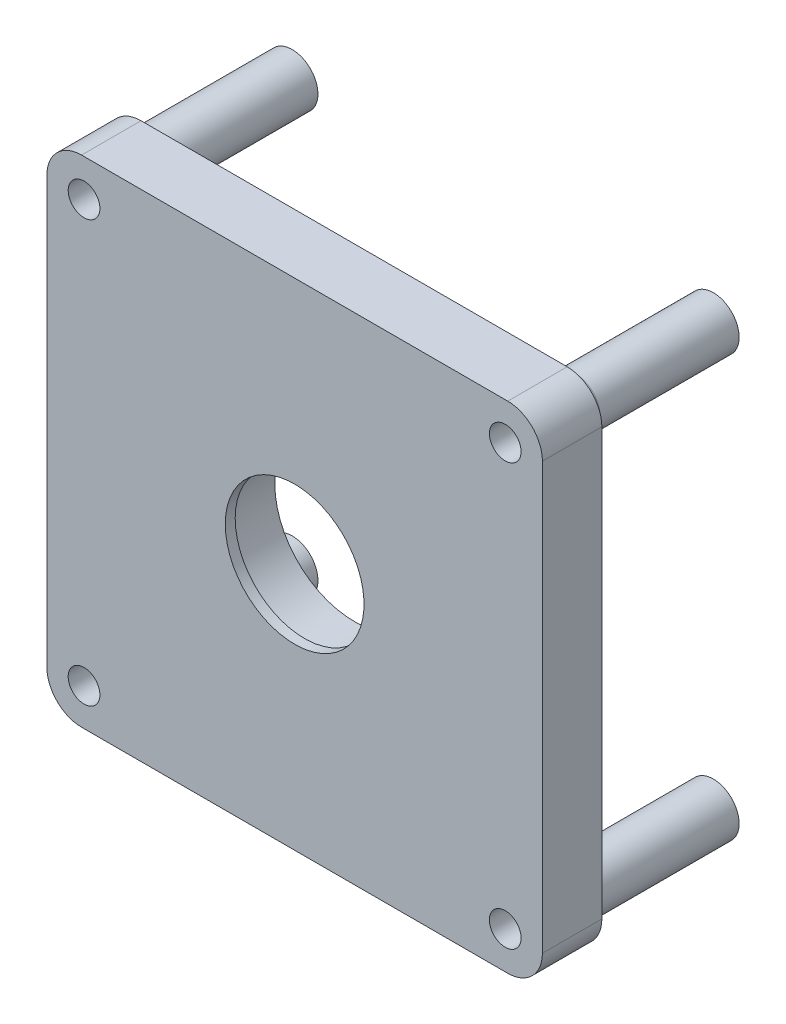
from build123d import *

# Parameters (mm, degrees)
SKETCH2_W            = 100
SKETCH2_H            = 100
BOSS_EXTRUDE1_DEPTH  = 12
SKETCH3_R            = 16
CUT_EXTRUDE1_DEPTH   = 10
M6_CLEARANCE_HOLE1_D = 6.4
BOSS_EXTRUDE2_START  = 30
SKETCH17_R           = 5.2
SKETCH17_R_2         = 3.2
BOSS_EXTRUDE2_DEPTH  = 30
CIRPATTERN1_COUNT    = 4
SKETCH18_R           = 14
CUT_EXTRUDE3_DEPTH   = 77.811457479
FILLET1_R            = 2
FILLET2_R            = 7


with BuildPart() as part:
    # Sketch2 → Boss-Extrude1 (new body)
    with BuildSketch(Plane.XY):
        Rectangle(SKETCH2_W, SKETCH2_H)
    extrude(amount=BOSS_EXTRUDE1_DEPTH)

    # Sketch3 → Cut-Extrude1 (cut)
    with BuildSketch(Plane(origin=(0, 0, 0), x_dir=(-1, 0, 0), z_dir=(0, 0, -1))):
        Circle(SKETCH3_R)
    extrude(amount=-CUT_EXTRUDE1_DEPTH, mode=Mode.SUBTRACT)

    # M6 Clearance Hole1 (through all)
    with Locations(Plane(origin=(0, 0, 12), x_dir=(-1, 0, 0), z_dir=(0, 0, 1))):
        with Locations((42.5, -42.5), (-42.5, 42.5), (-42.5, -42.5), (42.5, 42.5)):
            Hole(M6_CLEARANCE_HOLE1_D / 2)

    # Sketch17 → Boss-Extrude2 (add)
    with BuildSketch(Plane(origin=(0, 0, 0), x_dir=(-1, 0, 0), z_dir=(0, 0, -1)).offset(BOSS_EXTRUDE2_START)):
        with Locations((-42.5, 42.5)):
            Circle(SKETCH17_R)
        with Locations((-42.5, 42.5)):
            Circle(SKETCH17_R_2, mode=Mode.SUBTRACT)
    boss_extrude2 = extrude(amount=-BOSS_EXTRUDE2_DEPTH)

    # CirPattern1: Boss-Extrude2 ×4 about axis
    cirpattern1_axis = Axis((0, 0, -0.635), (0, 0, 1))
    for i in range(1, CIRPATTERN1_COUNT):
        add(boss_extrude2.rotate(cirpattern1_axis, i * 360 / CIRPATTERN1_COUNT))

    # Sketch18 → Cut-Extrude3 (cut, through all)
    with BuildSketch(Plane(origin=(0, 0, 0), x_dir=(-1, 0, 0), z_dir=(0, 0, -1))):
        Circle(SKETCH18_R)
    extrude(amount=-CUT_EXTRUDE3_DEPTH, mode=Mode.SUBTRACT)

    # Fillet1
    fillet1_edges = [part.edges().sort_by_distance(p)[0] for p in [
        (47.7, 42.5, 0),
        (-42.5, 47.7, 0),
        (-47.7, -42.5, 0),
        (42.5, -47.7, 0),
    ]]
    fillet(fillet1_edges, radius=FILLET1_R)

    # Fillet2
    fillet2_edges = [part.edges().sort_by_distance(p)[0] for p in [
        (-50, -50, 6),
        (50, -50, 6),
        (50, 50, 6),
        (-50, 50, 6),
    ]]
    fillet(fillet2_edges, radius=FILLET2_R)


solid = part.part
